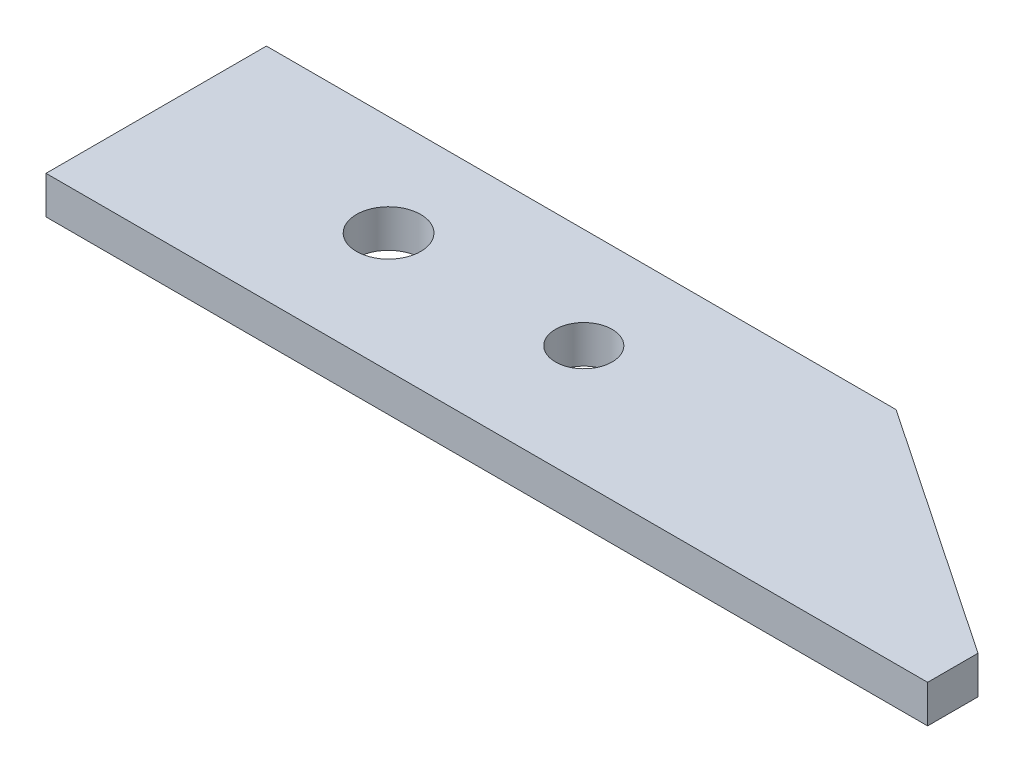
from build123d import *

# Parameters (mm, degrees)
SKETCH1_W           = 140
SKETCH1_H           = 35
BOSS_EXTRUDE1_DEPTH = 6
SKETCH2_R           = 4.5
SKETCH2_R_2         = 5.1
CUT_EXTRUDE1_DEPTH  = 145.433375644
CUT_EXTRUDE2_DEPTH  = 145.433375644


with BuildPart() as part:
    # Sketch1 → Boss-Extrude1 (new body)
    with BuildSketch(Plane(origin=(0, 0, 0), x_dir=(1, 0, 0), z_dir=(0, 1, 0))):
        with Locations((70, 17.5)):
            Rectangle(SKETCH1_W, SKETCH1_H)
    extrude(amount=BOSS_EXTRUDE1_DEPTH)

    # Sketch2 → Cut-Extrude1 (cut, through all)
    with BuildSketch(Plane(origin=(0, 6, 0), x_dir=(1, 0, 0), z_dir=(0, 1, 0))):
        with Locations((66.4, 19)):
            Circle(SKETCH2_R)
        with Locations((35.4, 19)):
            Circle(SKETCH2_R_2)
    extrude(amount=-CUT_EXTRUDE1_DEPTH, mode=Mode.SUBTRACT)

    # Sketch3 → Cut-Extrude2 (cut, through all)
    with BuildSketch(Plane(origin=(0, 6, 0), x_dir=(1, 0, 0), z_dir=(0, 1, 0))):
        Polygon((140, 8), (100, 35), (140, 35), align=None)
    extrude(amount=-CUT_EXTRUDE2_DEPTH, mode=Mode.SUBTRACT)


solid = part.part
